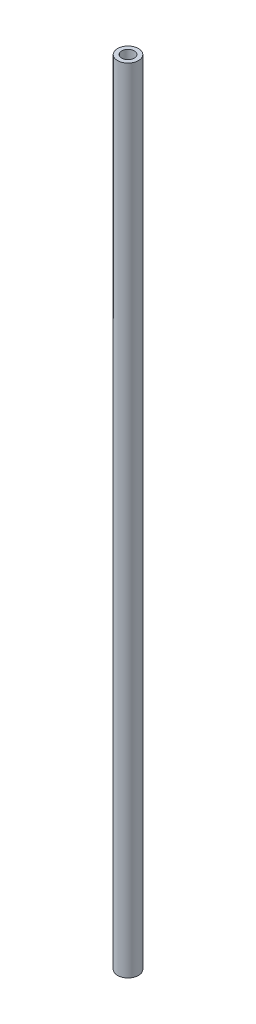
from build123d import *

# Parameters (mm, degrees)
SKETCH1_R           = 4.0259
SKETCH1_R_2         = 2.4384
BOSS_EXTRUDE1_DEPTH = 304.8


with BuildPart() as part:
    # Sketch1 → Boss-Extrude1 (new body)
    with BuildSketch(Plane(origin=(0, 0, 0), x_dir=(1, 0, 0), z_dir=(0, 1, 0))):
        Circle(SKETCH1_R)
        Circle(SKETCH1_R_2, mode=Mode.SUBTRACT)
    extrude(amount=BOSS_EXTRUDE1_DEPTH)


solid = part.part
